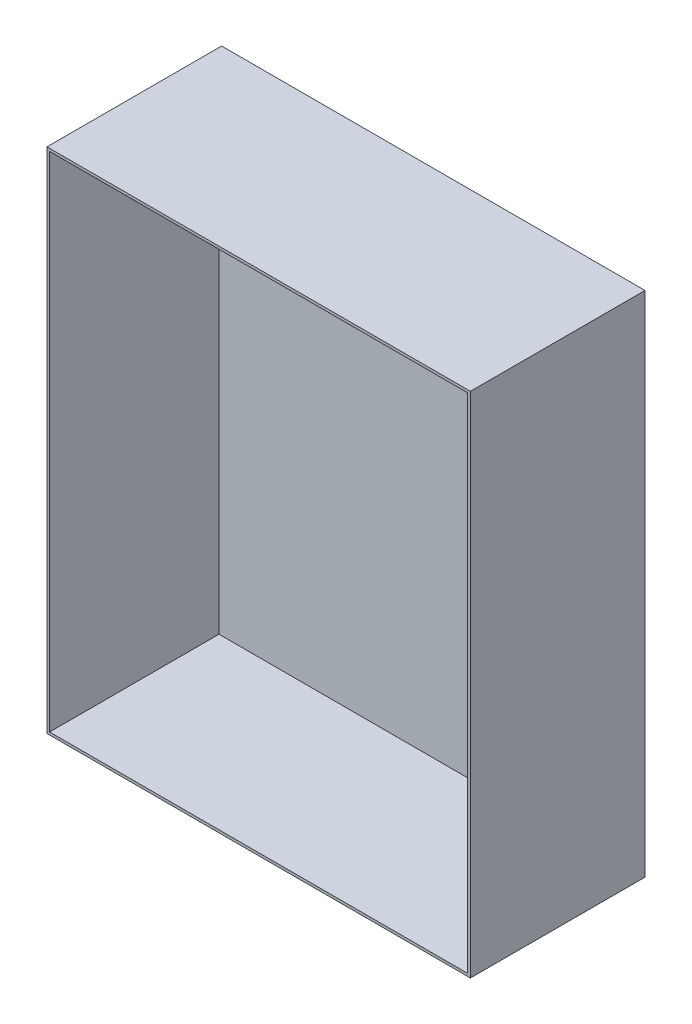
from build123d import *

# Parameters (mm, degrees)
SKETCH1_W           = 127
SKETCH1_H           = 152.4
BOSS_EXTRUDE1_DEPTH = 1.5875
SKETCH2_W           = 127
SKETCH2_H           = 152.4
SKETCH2_W_2         = 125.4125
SKETCH2_H_2         = 150.8125
EXTRUDE_THIN1_DEPTH = 50.8


with BuildPart() as part:
    # Sketch1 → Boss-Extrude1 (new body)
    with BuildSketch(Plane.XY):
        with Locations((-63.5, 76.2)):
            Rectangle(SKETCH1_W, SKETCH1_H)
    extrude(amount=BOSS_EXTRUDE1_DEPTH)

    # Sketch2 → Extrude-Thin1 (add)
    with BuildSketch(Plane.XY.offset(1.5875)):
        with Locations((-63.5, 76.2)):
            Rectangle(SKETCH2_W, SKETCH2_H)
        with Locations((-63.5, 76.2)):
            Rectangle(SKETCH2_W_2, SKETCH2_H_2, mode=Mode.SUBTRACT)
    extrude(amount=EXTRUDE_THIN1_DEPTH)


solid = part.part
